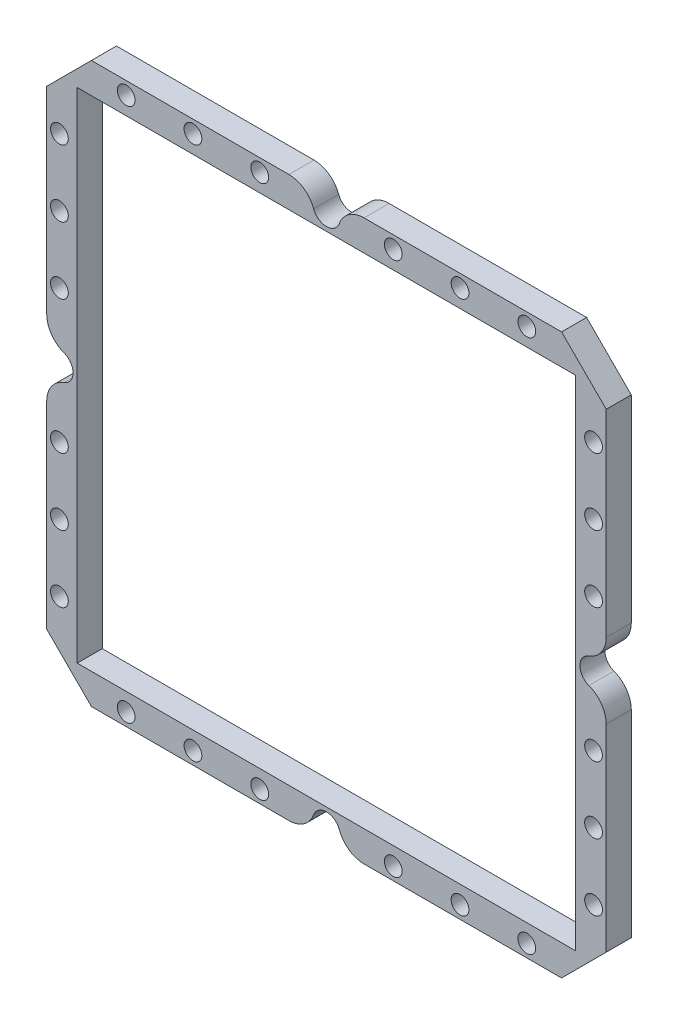
from build123d import *

# Parameters (mm, degrees)
SKETCH1_R           = 3.38
SKETCH1_W           = 189.625170906
SKETCH1_H           = 189.625170906
BOSS_EXTRUDE1_DEPTH = 9.525
FILLET1_R           = 10


with BuildPart() as part:
    # Sketch1 → Boss-Extrude1 (new body)
    with BuildSketch(Plane.XY):
        with BuildLine():
            Line((16.997849507, 0), (0, -16.997849507))
            Line((0, -16.997849507), (0, -104.504938707))
            ThreePointArc((0, -104.504938707), (5.804023693, -101.324605863), (10.0203, -106.426))
            ThreePointArc((10.0203, -106.426), (5.804023693, -111.527394137), (0, -108.347061293))
            Line((0, -108.347061293), (0, -195.854150493))
            Line((0, -195.854150493), (16.997849507, -212.852))
            Line((16.997849507, -212.852), (104.504938707, -212.852))
            ThreePointArc((104.504938707, -212.852), (103.510336798, -203.727202426), (111.6203, -208.026))
            ThreePointArc((111.6203, -208.026), (110.724797574, -210.941663202), (108.347061293, -212.852))
            Line((108.347061293, -212.852), (195.854150493, -212.852))
            Line((195.854150493, -212.852), (212.852, -195.854150493))
            Line((212.852, -195.854150493), (212.852, -108.347061293))
            ThreePointArc((212.852, -108.347061293), (202.8317, -106.426), (212.852, -104.504938707))
            Line((212.852, -104.504938707), (212.852, -16.997849507))
            Line((212.852, -16.997849507), (195.854150493, 0))
            Line((195.854150493, 0), (108.347061293, 0))
            ThreePointArc((108.347061293, 0), (110.724797574, -1.910336798), (111.6203, -4.826))
            ThreePointArc((111.6203, -4.826), (103.510336798, -9.124797574), (104.504938707, 0))
            Line((104.504938707, 0), (16.997849507, 0))
        make_face()
        with Locations((30.226, -208.026)):
            Circle(SKETCH1_R, mode=Mode.SUBTRACT)
        with Locations((4.826, -182.626)):
            Circle(SKETCH1_R, mode=Mode.SUBTRACT)
        with Locations((55.626, -208.026)):
            Circle(SKETCH1_R, mode=Mode.SUBTRACT)
        with Locations((81.026, -208.026)):
            Circle(SKETCH1_R, mode=Mode.SUBTRACT)
        with Locations((4.826, -157.226)):
            Circle(SKETCH1_R, mode=Mode.SUBTRACT)
        with Locations((4.826, -131.826)):
            Circle(SKETCH1_R, mode=Mode.SUBTRACT)
        with Locations((106.426, -106.426)):
            Rectangle(SKETCH1_W, SKETCH1_H, mode=Mode.SUBTRACT)
        with Locations((131.826, -208.026)):
            Circle(SKETCH1_R, mode=Mode.SUBTRACT)
        with Locations((157.226, -208.026)):
            Circle(SKETCH1_R, mode=Mode.SUBTRACT)
        with Locations((182.626, -208.026)):
            Circle(SKETCH1_R, mode=Mode.SUBTRACT)
        with Locations((208.026, -182.626)):
            Circle(SKETCH1_R, mode=Mode.SUBTRACT)
        with Locations((208.026, -157.226)):
            Circle(SKETCH1_R, mode=Mode.SUBTRACT)
        with Locations((208.026, -131.826)):
            Circle(SKETCH1_R, mode=Mode.SUBTRACT)
        with Locations((4.826, -81.026)):
            Circle(SKETCH1_R, mode=Mode.SUBTRACT)
        with Locations((4.826, -55.626)):
            Circle(SKETCH1_R, mode=Mode.SUBTRACT)
        with Locations((4.826, -30.226)):
            Circle(SKETCH1_R, mode=Mode.SUBTRACT)
        with Locations((30.226, -4.826)):
            Circle(SKETCH1_R, mode=Mode.SUBTRACT)
        with Locations((55.626, -4.826)):
            Circle(SKETCH1_R, mode=Mode.SUBTRACT)
        with Locations((81.026, -4.826)):
            Circle(SKETCH1_R, mode=Mode.SUBTRACT)
        with Locations((208.026, -81.026)):
            Circle(SKETCH1_R, mode=Mode.SUBTRACT)
        with Locations((208.026, -55.626)):
            Circle(SKETCH1_R, mode=Mode.SUBTRACT)
        with Locations((131.826, -4.826)):
            Circle(SKETCH1_R, mode=Mode.SUBTRACT)
        with Locations((157.226, -4.826)):
            Circle(SKETCH1_R, mode=Mode.SUBTRACT)
        with Locations((208.026, -30.226)):
            Circle(SKETCH1_R, mode=Mode.SUBTRACT)
        with Locations((182.626, -4.826)):
            Circle(SKETCH1_R, mode=Mode.SUBTRACT)
    extrude(amount=BOSS_EXTRUDE1_DEPTH)

    # Fillet1
    fillet1_edges = [part.edges().sort_by_distance(p)[0] for p in [
        (212.852, -108.347061293, 4.7625),
        (212.852, -104.504938707, 4.7625),
        (104.504938707, -212.852, 4.7625),
        (108.347061293, -212.852, 4.7625),
        (0, -108.347061293, 4.7625),
        (0, -104.504938707, 4.7625),
        (108.347061293, 0, 4.7625),
        (104.504938707, 0, 4.7625),
    ]]
    fillet(fillet1_edges, radius=FILLET1_R)


solid = part.part
